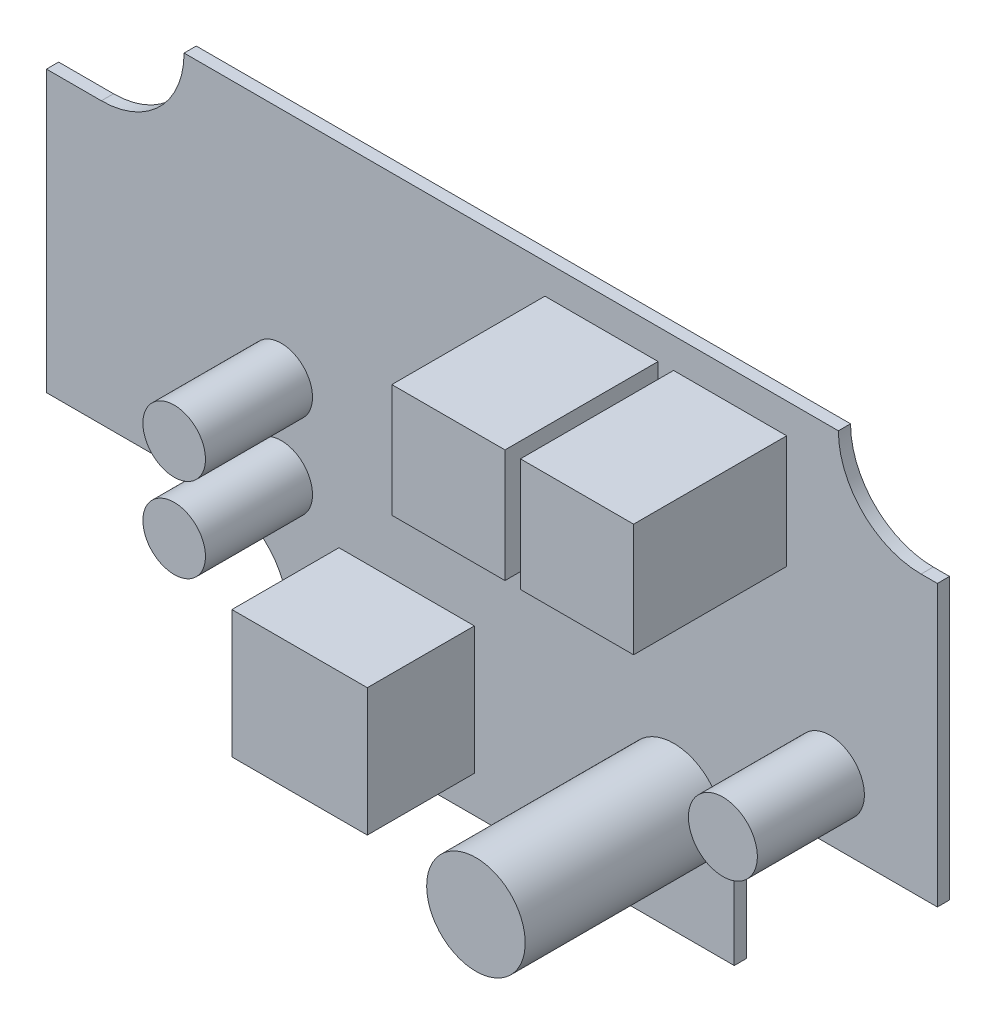
from build123d import *

# Parameters (mm, degrees)
BOSS_EXTRUDE1_DEPTH = 1.5748
SKETCH2_W           = 14.65
SKETCH2_H           = 14.65
BOSS_EXTRUDE2_DEPTH = 19.82
SKETCH3_R           = 6.38
BOSS_EXTRUDE3_DEPTH = 25.62
SKETCH4_R           = 4.05
SKETCH4_R_2         = 4.45846
SKETCH4_W           = 17.528842204
SKETCH4_H           = 16.527194078
BOSS_EXTRUDE4_DEPTH = 13.86


with BuildPart() as part:
    # Sketch1 → Boss-Extrude1 (new body)
    with BuildSketch(Plane.XY):
        with BuildLine():
            Line((28.872851827, -26.077881523), (28.872851827, -36.404326876))
            Line((28.872851827, -36.404326876), (-28.872851827, -36.404326876))
            Line((-28.872851827, -36.404326876), (-28.872851827, -26.077881523))
            ThreePointArc((-28.872851827, -26.077881523), (-31.621419365, -19.442252496), (-38.257048392, -16.693684958))
            Line((-38.257048392, -16.693684958), (-60.169314401, -16.693684958))
            Line((-60.169314401, -16.693684958), (-60.169314401, 19.589257803))
            Line((-60.169314401, 19.589257803), (-53.061571168, 19.589257803))
            ThreePointArc((-53.061571168, 19.589257803), (-45.490240762, 22.725405542), (-42.354093023, 30.296735947))
            Line((-42.354093023, 30.296735947), (42.354093023, 30.296735947))
            ThreePointArc((42.354093023, 30.296735947), (45.490240762, 22.725405542), (53.061571168, 19.589257803))
            Line((53.061571168, 19.589257803), (55.168857487, 19.589257803))
            Line((55.168857487, 19.589257803), (55.168857487, -16.693684958))
            Line((55.168857487, -16.693684958), (38.257048392, -16.693684958))
            ThreePointArc((38.257048392, -16.693684958), (31.621419365, -19.442252496), (28.872851827, -26.077881523))
        make_face()
    extrude(amount=BOSS_EXTRUDE1_DEPTH)

    # Sketch2 → Boss-Extrude2 (add)
    with BuildSketch(Plane.XY.offset(1.5748)):
        with Locations((11.686894588, 19.066351865)):
            Rectangle(SKETCH2_W, SKETCH2_H)
        with Locations((28.336894588, 19.066351865)):
            Rectangle(SKETCH2_W, SKETCH2_H)
    extrude(amount=BOSS_EXTRUDE2_DEPTH)

    # Sketch3 → Boss-Extrude3 (add)
    with BuildSketch(Plane.XY.offset(1.5748)):
        with Locations((21.050882576, -21.779136192)):
            Circle(SKETCH3_R)
    extrude(amount=BOSS_EXTRUDE3_DEPTH)

    # Sketch4 → Boss-Extrude4 (add)
    with BuildSketch(Plane.XY.offset(1.5748)):
        with Locations((-29.775377187, 0)):
            Circle(SKETCH4_R)
        with Locations((-29.775377187, -10.91000664)):
            Circle(SKETCH4_R)
        with Locations((41.26131402, -8.841126254)):
            Circle(SKETCH4_R_2)
        with Locations((-13.538274313, -23.407391016)):
            Rectangle(SKETCH4_W, SKETCH4_H)
    extrude(amount=BOSS_EXTRUDE4_DEPTH)


solid = part.part
